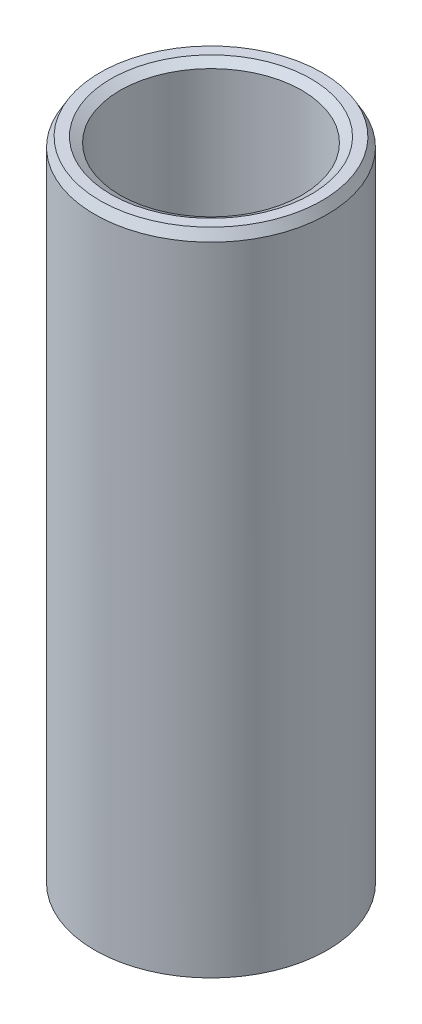
from build123d import *
from OCP.BRepFilletAPI import BRepFilletAPI_MakeChamfer

# Parameters (mm, degrees)
SKETCH1_R           = 30
BOSS_EXTRUDE1_DEPTH = 168.103531059
SKETCH2_R           = 23.431402699
CUT_EXTRUDE1_DEPTH  = 174.374730438
CHAMFER1_SIZE       = 2.386308981
CHAMFER1_SIZE2      = 1.377736133


with BuildPart() as part:
    # Sketch1 → Boss-Extrude1 (new body)
    with BuildSketch(Plane(origin=(0, 0, 0), x_dir=(1, 0, 0), z_dir=(0, 1, 0))):
        Circle(SKETCH1_R)
    extrude(amount=BOSS_EXTRUDE1_DEPTH)

    # Sketch2 → Cut-Extrude1 (cut, through all)
    with BuildSketch(Plane(origin=(0, 0, 0), x_dir=(1, 0, 0), z_dir=(0, 1, 0))):
        Circle(SKETCH2_R)
    extrude(amount=CUT_EXTRUDE1_DEPTH, mode=Mode.SUBTRACT)

    # Chamfer1: one chamfer whose edges measure the first distance from different faces: ONE call of the kernel's chamfer builder (chamfer() names one face for all edges)
    chamfer1_edges_1 = [part.edges().sort_by_distance(p)[0] for p in [
        (-23.431402699, 168.103531059, 0),
    ]]
    chamfer1_side_1 = [part.faces().sort_by_distance(p)[0] for p in [
        (-29.151471863, 168.103531059, 0),
    ]]
    chamfer1_edges_2 = [part.edges().sort_by_distance(p)[0] for p in [
        (-23.431402699, 0, 0),
    ]]
    chamfer1_side_2 = [part.faces().sort_by_distance(p)[0] for p in [
        (-23.431402699, 84.051765529, 0),
    ]]
    chamfer1_edges_3 = [part.edges().sort_by_distance(p)[0] for p in [
        (-30, 0, 0),
    ]]
    chamfer1_side_3 = [part.faces().sort_by_distance(p)[0] for p in [
        (-29.151471863, 0, 0),
    ]]
    chamfer1_edges_4 = [part.edges().sort_by_distance(p)[0] for p in [
        (-30, 168.103531059, 0),
    ]]
    chamfer1_side_4 = [part.faces().sort_by_distance(p)[0] for p in [
        (-30, 84.051765529, 0),
    ]]
    chamfer1 = BRepFilletAPI_MakeChamfer(part.part.solid().wrapped)
    for e in chamfer1_edges_1:
        chamfer1.Add(CHAMFER1_SIZE, CHAMFER1_SIZE2, e.wrapped, chamfer1_side_1[0].wrapped)  # the first distance lies on this face
    for e in chamfer1_edges_2:
        chamfer1.Add(CHAMFER1_SIZE, CHAMFER1_SIZE2, e.wrapped, chamfer1_side_2[0].wrapped)  # the first distance lies on this face
    for e in chamfer1_edges_3:
        chamfer1.Add(CHAMFER1_SIZE, CHAMFER1_SIZE2, e.wrapped, chamfer1_side_3[0].wrapped)  # the first distance lies on this face
    for e in chamfer1_edges_4:
        chamfer1.Add(CHAMFER1_SIZE, CHAMFER1_SIZE2, e.wrapped, chamfer1_side_4[0].wrapped)  # the first distance lies on this face
    add(Compound.cast(chamfer1.Shape()), mode=Mode.REPLACE)


solid = part.part
